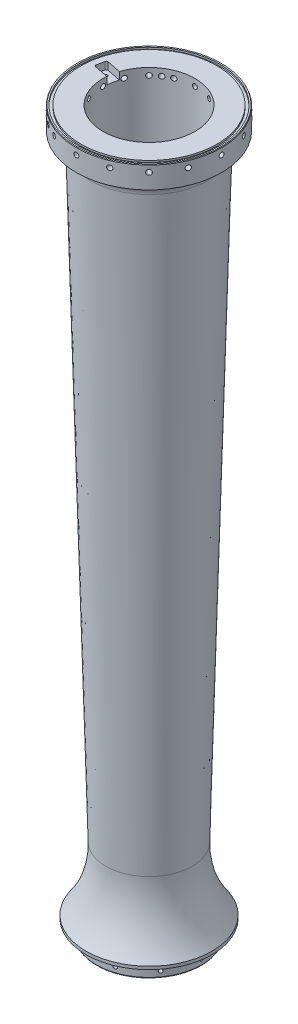
from build123d import *

# Parameters (mm, degrees)
HOLE_WIZARD_M4_1_D       = 3.3
HOLE_WIZARD_M4_1_DEPTH   = 49
PATTERN_CIRCULAR_1_COUNT = 16
HOLE_WIZARD_M3_1_D       = 2.5
HOLE_WIZARD_M3_1_DEPTH   = 35.5
PATTERN_CIRCULAR_2_COUNT = 10
PATTERN_CIRCULAR_3_COUNT = 2
PATTERN_CIRCULAR_3_ANGLE = 126.00000000000028
PATTERN_CIRCULAR_4_COUNT = 2
PATTERN_CIRCULAR_4_ANGLE = 123.7500000000003
PATTERN_CIRCULAR_5_COUNT = 2
PATTERN_CIRCULAR_5_ANGLE = 123.75000000000027
CUT_EXTRUDE_1_DEPTH      = 5
FILLET_5_R               = 1
HOLE_WIZARD_M3_2_D       = 2.5
HOLE_WIZARD_M3_2_DEPTH   = 7.5
HOLE_WIZARD_M3_2_TIP     = 0.7510757737844503
PATTERN_CIRCULAR_6_COUNT = 2
PATTERN_CIRCULAR_6_ANGLE = 126.00000000000028
CUT_EXTRUDE_2_DEPTH      = 5
FILLET_6_R               = 1
HOLE_WIZARD_M3_3_D       = 2.5
HOLE_WIZARD_M3_3_DEPTH   = 7.5
HOLE_WIZARD_M3_3_TIP     = 0.7510757737844503
CHAMFER_1_SIZE           = 0.5
CHAMFER_1_SIZE2          = 0.28867513459481364
CHAMFER_2_SIZE           = 0.3
CHAMFER_2_SIZE2          = 0.519615242270666
SKETCH_16_R              = 34.25
SKETCH_16_R_2            = 33
CUT_EXTRUDE_3_DEPTH      = 0.7
SKETCH_17_R              = 47.75
SKETCH_17_R_2            = 45.85
CUT_EXTRUDE_4_DEPTH      = 1.2
FILLET_7_R               = 9.5
SKETCH_25_R              = 27.5
CUT_EXTRUDE_6_DEPTH      = 150
FILLET_10_R              = 1


# Some blends are built 0.0001 mm under size
with BuildPart() as part:
    # 草图1 → 旋转1 (revolve)
    with BuildSketch(Plane.XY, mode=Mode.PRIVATE) as revolve_1_sk:
        with BuildLine():
            Line((-30.99999999999998, 0), (-49, -1.41e-15))
            Line((-49, -1.41e-15), (-49, -15.000000000000002))
            Line((-49, -15.000000000000002), (-40, -15.000000000000002))
            Line((-40, -15.000000000000002), (-29.024099404793738, -430.17650415952505))
            ThreePointArc((-29.024099404793738, -430.17650415952505), (-32.18237222123477, -452.7132777120358), (-42.49999999999996, -472.99695110614937))
            Line((-42.49999999999996, -472.99695110614937), (-42.49999999999995, -475))
            Line((-42.49999999999995, -475), (-35.499999999999936, -475))
            Line((-35.499999999999936, -475), (-35.49999999999994, -485))
            Line((-35.49999999999994, -485), (-25.49999999999994, -485))
            Line((-25.49999999999994, -485), (-25.49999999999997, -175))
            Line((-25.49999999999997, -175), (-30.999999999999964, -175))
            Line((-30.999999999999964, -175), (-30.99999999999998, 0))
        make_face()
    revolve(revolve_1_sk.sketch.rotate(Axis((0, 0, 0), (0, -1, 0)), 270), axis=Axis((0, 0, 0), (0, -1, 0)))

    # M4 螺纹孔1
    with Locations(Plane(origin=(49, 0, 0), x_dir=(0, 0, -1), z_dir=(1, 0, 0))):
        with Locations((0, -4.7)):
            hole_wizard_m4_1 = Hole(HOLE_WIZARD_M4_1_D / 2, depth=HOLE_WIZARD_M4_1_DEPTH)

    # 阵列(圆周)1: M4 螺纹孔1 ×16 about axis
    pattern_circular_1_axis = Axis((0, 0, 0), (0, 1, 0))
    for i in range(1, PATTERN_CIRCULAR_1_COUNT):
        add(hole_wizard_m4_1.rotate(pattern_circular_1_axis, i * 360 / PATTERN_CIRCULAR_1_COUNT), mode=Mode.SUBTRACT)

    # M3 螺纹孔1
    with Locations(Plane(origin=(35.499999999999936, 0, 0), x_dir=(0, 0, -1), z_dir=(1, 0, 0))):
        with Locations((0, -481)):
            hole_wizard_m3_1 = Hole(HOLE_WIZARD_M3_1_D / 2, depth=HOLE_WIZARD_M3_1_DEPTH)

    # 阵列(圆周)2: M3 螺纹孔1 ×10 about axis
    pattern_circular_2_axis = Axis((0, 0, 0), (0, 1, 0))
    for i in range(1, PATTERN_CIRCULAR_2_COUNT):
        add(hole_wizard_m3_1.rotate(pattern_circular_2_axis, i * 360 / PATTERN_CIRCULAR_2_COUNT), mode=Mode.SUBTRACT)

    # 阵列(圆周)3: M3 螺纹孔1 ×2 about axis
    pattern_circular_3_axis = Axis((0, 0, 0), (0, 1, 0))
    for i in range(1, PATTERN_CIRCULAR_3_COUNT):
        add(hole_wizard_m3_1.rotate(pattern_circular_3_axis, i * PATTERN_CIRCULAR_3_ANGLE / (PATTERN_CIRCULAR_3_COUNT - 1)), mode=Mode.SUBTRACT)

    # 阵列(圆周)4: M4 螺纹孔1 ×2 about axis
    pattern_circular_4_axis = Axis((0, 0, 0), (0, 1, 0))
    for i in range(1, PATTERN_CIRCULAR_4_COUNT):
        add(hole_wizard_m4_1.rotate(pattern_circular_4_axis, i * PATTERN_CIRCULAR_4_ANGLE / (PATTERN_CIRCULAR_4_COUNT - 1)), mode=Mode.SUBTRACT)

    # 阵列(圆周)5: M4 螺纹孔1 ×2 about axis
    pattern_circular_5_axis = Axis((0, 0, 0), (0, -1, 0))
    for i in range(1, PATTERN_CIRCULAR_5_COUNT):
        add(hole_wizard_m4_1.rotate(pattern_circular_5_axis, i * PATTERN_CIRCULAR_5_ANGLE / (PATTERN_CIRCULAR_5_COUNT - 1)), mode=Mode.SUBTRACT)

    # 草图10 → 切除-拉伸1 (cut)
    with BuildSketch(Plane(origin=(0, 0, 0), x_dir=(1, 0, 0), z_dir=(0, 1, 0))):
        Polygon((-40.00026397747608, 11.627075373120666), (-28.230840612637294, 9.285991508927209), (-29.63549093115337, 2.2243374900239417), (-41.40491429599216, 4.5654213542173965), align=None)
    extrude(amount=-CUT_EXTRUDE_1_DEPTH, mode=Mode.SUBTRACT)

    # 圆角5
    fillet_5_edges = [part.edges().sort_by_distance(p)[0] for p in [
        (-41.40491429599216, -2.5, -4.5654213542173965),
        (-40.00026397747608, -2.5, -11.627075373120666),
    ]]
    fillet(fillet_5_edges, radius=FILLET_5_R)

    # M3 螺纹孔2
    with Locations(Plane(origin=(0, -5, 0), x_dir=(1, 0, 0), z_dir=(0, 1, 0))):
        with Locations((-36.779448015, 7.315887076)):
            Hole(HOLE_WIZARD_M3_2_D / 2, depth=HOLE_WIZARD_M3_2_DEPTH)
            with Locations((0, 0, -(HOLE_WIZARD_M3_2_DEPTH + HOLE_WIZARD_M3_2_TIP / 2))):  # 118° drill point
                Cone(0, HOLE_WIZARD_M3_2_D / 2, HOLE_WIZARD_M3_2_TIP, mode=Mode.SUBTRACT)

    # 阵列(圆周)6: M3 螺纹孔1 ×2 about axis
    pattern_circular_6_axis = Axis((0, 0, 0), (0, -1, 0))
    for i in range(1, PATTERN_CIRCULAR_6_COUNT):
        add(hole_wizard_m3_1.rotate(pattern_circular_6_axis, i * PATTERN_CIRCULAR_6_ANGLE / (PATTERN_CIRCULAR_6_COUNT - 1)), mode=Mode.SUBTRACT)

    # 草图13 → 切除-拉伸2 (cut)
    with BuildSketch(Plane.XZ.offset(485)):
        Polygon((-28.845819083547457, -13.157838781473414), (-17.433140888005614, -9.449634848974032), (-19.65806324750525, -2.602027931648927), (-31.070741443047087, -6.3102318641483075), align=None)
    extrude(amount=-CUT_EXTRUDE_2_DEPTH, mode=Mode.SUBTRACT)

    # 圆角6
    fillet_6_edges = [part.edges().sort_by_distance(p)[0] for p in [
        (-28.845819083547457, -482.5, -13.157838781473414),
        (-31.070741443047087, -482.5, -6.3102318641483075),
    ]]
    fillet(fillet_6_edges, radius=FILLET_6_R)

    # M3 螺纹孔3
    with Locations(Plane(origin=(0, -480, 0), x_dir=(-1, 0, 0), z_dir=(0, -1, 0))):
        with Locations((26.629582456, 8.652475842)):
            Hole(HOLE_WIZARD_M3_3_D / 2, depth=HOLE_WIZARD_M3_3_DEPTH)
            with Locations((0, 0, -(HOLE_WIZARD_M3_3_DEPTH + HOLE_WIZARD_M3_3_TIP / 2))):  # 118° drill point
                Cone(0, HOLE_WIZARD_M3_3_D / 2, HOLE_WIZARD_M3_3_TIP, mode=Mode.SUBTRACT)

    # 倒角1
    chamfer_1_edges = [part.edges().sort_by_distance(p)[0] for p in [
        (-1.688e-14, -1.41e-15, -49),
    ]]
    chamfer_1_side = [part.faces().sort_by_distance(p)[0] for p in [
        (-1.688e-14, -7.500000000000002, -49),
    ]]
    chamfer(chamfer_1_edges, length=CHAMFER_1_SIZE, length2=CHAMFER_1_SIZE2, reference=chamfer_1_side[0])

    # 倒角2
    chamfer_2_edges = [part.edges().sort_by_distance(p)[0] for p in [
        (-1.223e-14, -485, -35.49999999999994),
    ]]
    chamfer_2_side = [part.faces().sort_by_distance(p)[0] for p in [
        (-27.93087670528377, -485, -4.23426354947491),
    ]]
    chamfer(chamfer_2_edges, length=CHAMFER_2_SIZE, length2=CHAMFER_2_SIZE2, reference=chamfer_2_side[0])

    # 草图16 → 切除-拉伸3 (cut)
    with BuildSketch(Plane.XZ.offset(485)):
        with Locations(Location((0, 0, 0), (0, 0, 270))):
            Circle(SKETCH_16_R)
        with Locations(Location((0, 0, 0), (0, 0, 270))):
            Circle(SKETCH_16_R_2, mode=Mode.SUBTRACT)
    extrude(amount=-CUT_EXTRUDE_3_DEPTH, mode=Mode.SUBTRACT)

    # 草图17 → 切除-拉伸4 (cut)
    with BuildSketch(Plane(origin=(0, 0, 0), x_dir=(1, 0, 0), z_dir=(0, 1, 0))):
        with Locations(Location((0, 0, 0), (0, 0, 270))):
            Circle(SKETCH_17_R)
        with Locations(Location((0, 0, 0), (0, 0, 270))):
            Circle(SKETCH_17_R_2, mode=Mode.SUBTRACT)
    extrude(amount=-CUT_EXTRUDE_4_DEPTH, mode=Mode.SUBTRACT)

    # 圆角7
    # the kernel refuses this fillet: 9.5 mm, written as the material it adds along each edge
    with BuildSketch(Plane(origin=(0, -15.000000000000002, 0), x_dir=(2.2e-16, 0, 1), z_dir=(1, 0, -2.2e-16))) as fillet_7_piece_1:
        with BuildLine():
            CenterArc((49.2522590110359, 9.49665021949062), FILLET_7_R, 181.51435914425352, 86.96405393885078)
            Line((49, 3.55e-15), (48.99495481977928, -0.1899330043898093))
            ThreePointArc((48.99495481977928, -0.1899330043898093), (44.5, -0.1899999999999995), (40, -0.1899999999999995))
            Line((40, -0.1899999999999995), (39.81006636067987, -0.00502122043029374))
            Line((39.81006636067987, -0.00502122043029374), (39.56564340570912, 9.240567977545664))
            Line((39.56564340570912, 9.240567977545664), (39.75557704502925, 9.245589197975958))
        make_face()
    revolve(axis=Axis((0, -15.000000000000002, 0), (0, -1, 0)))

    # 草图25 → 切除-拉伸6 (cut)
    with BuildSketch(Plane(origin=(0, -175, 0), x_dir=(1, 0, 0), z_dir=(0, 1, 0))):
        with Locations(Location((0, 0, 0), (0, 0, 270))):
            Circle(SKETCH_25_R)
    extrude(amount=-CUT_EXTRUDE_6_DEPTH, mode=Mode.SUBTRACT)

    # 圆角10
    fillet_10_edges = [part.edges().sort_by_distance(p)[0] for p in [
        (-1.068e-14, -175, -30.999999999999964),
        (8.42e-15, -325, -27.5),
        (-2.54e-15, -325, -25.49999999999994),
        (8.42e-15, -175, -27.5),
    ]]
    fillet(fillet_10_edges, radius=FILLET_10_R - 0.0001)  # a hair under: the kernel refuses the full size


solid = part.part
